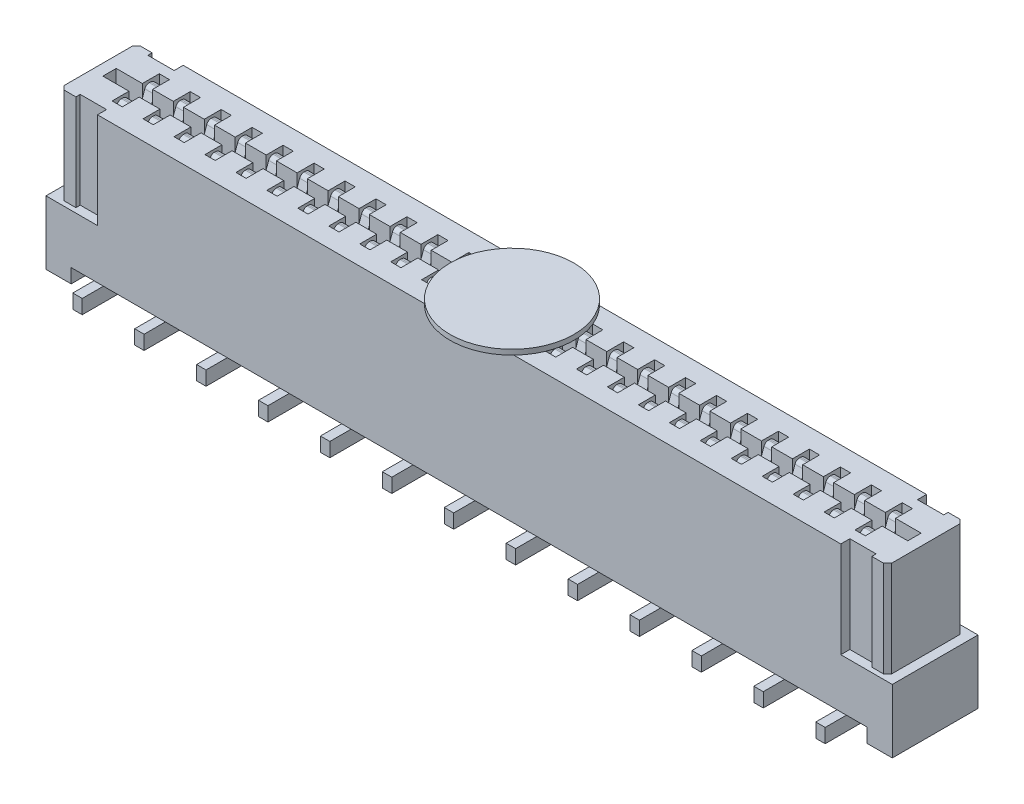
from build123d import *

# Parameters (mm, degrees)
SKETCH1_W                   = 27.33675
SKETCH1_H                   = 5.1562
BASE_DEPTH                  = 1.3843
SKETCH2_W                   = 2.7686
SKETCH2_H                   = 3.0988
SIDE_CUT_DEPTH              = 0.3048
SKETCH3_W                   = 0.508
SKETCH3_H                   = 3.0988
WELD_TAB_SLOT_DEPTH         = 0.1524
SKETCH4_W                   = 0.8509
SKETCH4_H                   = 3.0988
WT_RETENTION_SLOT_DEPTH     = 0.2921
SKETCH5_W                   = 25.71115
SKETCH5_H                   = 2.7686
STANDOFF_DEPTH              = 0.4572
MIRROR10_COPY_1_SKETCH_W    = 0.508
MIRROR10_COPY_1_SKETCH_H    = 3.0988
MIRROR10_COPY_1_DEPTH       = 0.1524
MIRROR10_COPY_2_SKETCH_W    = 0.8509
MIRROR10_COPY_2_SKETCH_H    = 3.0988
MIRROR10_COPY_2_DEPTH       = 0.2921
SKETCH7_W                   = 0.3302
SKETCH7_H                   = 1.8288
SLOT_CUT_DEPTH              = 1.397
CUT_EXTRUDE7_REACH          = 16.13
SKETCH8_W                   = 0.3302
SKETCH8_H                   = 1.524
SKETCH10_W                  = 25.999948
SKETCH10_H                  = 0.4318
CARD_SLOT_DEPTH             = 3.4544
POSITION_PATTERN_COUNT      = 25
POSITION_PATTERN_PITCH      = 0.999998
CHAMFER1_SIZE               = 0.127
F_01_LEAD_STYLE_PIN_R_DEPTH = 0.1524
F_01_PIN_R_PATTERN_COUNT    = 12
F_01_PIN_R_PATTERN_PITCH    = 1.999996
F_01_LEAD_STYLE_PIN_L_DEPTH = 0.1524
F_01_PIN_L_PATTERN_COUNT    = 13
F_01_PIN_L_PATTERN_PITCH    = 1.999996
SKETCH17_R                  = 2.00025
KAPTON_DEPTH                = 0.1651


with BuildPart() as part:
    # Sketch1 → Base (new, symmetric)
    with BuildSketch(Plane.XY):
        with Locations((0, 0.0635)):
            Rectangle(SKETCH1_W, SKETCH1_H)
    extrude(amount=BASE_DEPTH, both=True)

    # Sketch2 → Side Cut (cut)
    with BuildSketch(Plane(origin=(13.668375, 0, 0), x_dir=(0, 0, -1), z_dir=(1, 0, 0))):
        with Locations((0, 1.0922)):
            Rectangle(SKETCH2_W, SKETCH2_H)
    side_cut = extrude(amount=-SIDE_CUT_DEPTH, mode=Mode.SUBTRACT)

    # Sketch3 → Weld Tab Slot (cut)
    with BuildSketch(Plane.XY.offset(1.3843)):
        with Locations((13.109575, 1.0922)):
            Rectangle(SKETCH3_W, SKETCH3_H)
    weld_tab_slot = extrude(amount=-WELD_TAB_SLOT_DEPTH, mode=Mode.SUBTRACT)

    # Sketch4 → WT Retention Slot (cut)
    with BuildSketch(Plane.XY.offset(1.3843)):
        with Locations((12.430125, 1.0922)):
            Rectangle(SKETCH4_W, SKETCH4_H)
    wt_retention_slot = extrude(amount=-WT_RETENTION_SLOT_DEPTH, mode=Mode.SUBTRACT)

    # Sketch5 → Standoff (cut)
    with BuildSketch(Plane.XZ.offset(2.5146)):
        Rectangle(SKETCH5_W, SKETCH5_H)
    extrude(amount=-STANDOFF_DEPTH, mode=Mode.SUBTRACT)

    # Mirror8: Weld Tab Slot, WT Retention Slot across plane
    add(weld_tab_slot.mirror(Plane.XY), mode=Mode.SUBTRACT)
    add(wt_retention_slot.mirror(Plane.XY), mode=Mode.SUBTRACT)

    # Mirror10: Side Cut, Weld Tab Slot, WT Retention Slot across plane
    add(side_cut.mirror(Plane(origin=(0, 0, 0), x_dir=(0, 0, 1), z_dir=(1, 0, 0))), mode=Mode.SUBTRACT)
    add(weld_tab_slot.mirror(Plane(origin=(0, 0, 0), x_dir=(0, 0, 1), z_dir=(1, 0, 0))), mode=Mode.SUBTRACT)
    add(wt_retention_slot.mirror(Plane(origin=(0, 0, 0), x_dir=(0, 0, 1), z_dir=(1, 0, 0))), mode=Mode.SUBTRACT)

    # Mirror10 copy 1 sketch → Mirror10 copy 1 (cut)
    with BuildSketch(Plane(origin=(0, 0, -1.3843), x_dir=(-1, 0, 0), z_dir=(0, 0, -1))):
        with Locations((13.109575, 1.0922)):
            Rectangle(MIRROR10_COPY_1_SKETCH_W, MIRROR10_COPY_1_SKETCH_H)
    extrude(amount=-MIRROR10_COPY_1_DEPTH, mode=Mode.SUBTRACT)

    # Mirror10 copy 2 sketch → Mirror10 copy 2 (cut)
    with BuildSketch(Plane(origin=(0, 0, -1.3843), x_dir=(-1, 0, 0), z_dir=(0, 0, -1))):
        with Locations((12.430125, 1.0922)):
            Rectangle(MIRROR10_COPY_2_SKETCH_W, MIRROR10_COPY_2_SKETCH_H)
    extrude(amount=-MIRROR10_COPY_2_DEPTH, mode=Mode.SUBTRACT)

    # Sketch7 → Slot Cut (cut)
    with BuildSketch(Plane.XZ.offset(2.0574)):
        with Locations((12.008866, 0)):
            Rectangle(SKETCH7_W, SKETCH7_H)
    slot_cut = extrude(amount=-SLOT_CUT_DEPTH, mode=Mode.SUBTRACT)

    # Sketch8 → Cut-Extrude7 (cut, up to next)
    with BuildSketch(Plane.XZ.offset(0.6604), mode=Mode.PRIVATE) as cut_extrude7_sk1:
        with Locations((12.008866, 0)):
            Rectangle(SKETCH8_W, SKETCH8_H)
    cut_extrude7_tool1 = extrude(cut_extrude7_sk1.sketch, amount=-CUT_EXTRUDE7_REACH, mode=Mode.PRIVATE) & part.part
    cut_extrude7 = cut_extrude7_tool1.solids().sort_by_distance((12.008866, -0.6604, 0))[0]
    add(cut_extrude7, mode=Mode.SUBTRACT)

    # Sketch10 → Card slot (cut)
    with BuildSketch(Plane(origin=(0, 2.6416, 0), x_dir=(-1, 0, 0), z_dir=(0, 1, 0))):
        Rectangle(SKETCH10_W, SKETCH10_H)
    extrude(amount=-CARD_SLOT_DEPTH, mode=Mode.SUBTRACT)

    # Position Pattern: Slot Cut, Cut-Extrude7 ×25
    with Locations(*[(-i * POSITION_PATTERN_PITCH, 0, 0) for i in range(1, POSITION_PATTERN_COUNT)]):
        add(slot_cut, mode=Mode.SUBTRACT)
        add(cut_extrude7, mode=Mode.SUBTRACT)

    # Chamfer1
    chamfer1_edges = [part.edges().sort_by_distance(p)[0] for p in [
        (-13.363575, 1.0922, -1.2319),
        (13.363575, 1.0922, -1.2319),
        (13.363575, 1.0922, 1.2319),
        (-13.363575, 1.0922, 1.2319),
    ]]
    chamfer(chamfer1_edges, length=CHAMFER1_SIZE)

    # Sketch11 → -01 Lead Style Pin (R) (add, symmetric)
    with BuildSketch(Plane(origin=(11.008868, 0, 0), x_dir=(0, 0, -1), z_dir=(1, 0, 0))):
        with BuildLine():
            Line((0.6223, 2.413), (0.6223, -0.252665004))
            Line((0.6223, -0.252665004), (0.9017, -0.7366))
            Line((0.9017, -0.7366), (0.9017, -2.0828))
            Line((0.9017, -2.0828), (2.0447, -2.0828))
            Line((2.0447, -2.0828), (2.0447, -2.54))
            Line((2.0447, -2.54), (0.5334, -2.54))
            ThreePointArc((0.5334, -2.54), (0.443597439, -2.502802561), (0.4064, -2.413))
            Line((0.4064, -2.413), (0.4064, -2.2098))
            Line((0.4064, -2.2098), (-0.9017, -2.2098))
            Line((-0.9017, -2.2098), (-0.9017, -0.7366))
            Line((-0.9017, -0.7366), (-0.6223, -0.252665004))
            Line((-0.6223, -0.252665004), (-0.6223, 2.413))
            ThreePointArc((-0.6223, 2.413), (-0.577663073, 2.520763073), (-0.4699, 2.5654))
            Line((-0.4699, 2.5654), (-0.42760882, 2.5654))
            ThreePointArc((-0.42760882, 2.5654), (-0.339726472, 2.537508847), (-0.284011316, 2.464044266))
            Line((-0.284011316, 2.464044266), (-0.085506242, 1.905610664))
            ThreePointArc((-0.085506242, 1.905610664), (-0.063500101, 1.777722246), (-0.085692683, 1.649866049))
            Line((-0.085692683, 1.649866049), (-0.257822927, 1.16785804))
            ThreePointArc((-0.257822927, 1.16785804), (-0.264464333, 1.142612785), (-0.2667, 1.116604459))
            Line((-0.2667, 1.116604459), (-0.2667, -0.4699))
            ThreePointArc((-0.2667, -0.4699), (-0.188585379, -0.658485379), (0, -0.7366))
            ThreePointArc((0, -0.7366), (0.188585379, -0.658485379), (0.2667, -0.4699))
            Line((0.2667, -0.4699), (0.2667, 1.116604459))
            ThreePointArc((0.2667, 1.116604459), (0.264464333, 1.142612785), (0.257822927, 1.16785804))
            Line((0.257822927, 1.16785804), (0.085692683, 1.649866049))
            ThreePointArc((0.085692683, 1.649866049), (0.063500101, 1.777722246), (0.085506242, 1.905610664))
            Line((0.085506242, 1.905610664), (0.284011316, 2.464044266))
            ThreePointArc((0.284011316, 2.464044266), (0.339726472, 2.537508847), (0.42760882, 2.5654))
            Line((0.42760882, 2.5654), (0.4699, 2.5654))
            ThreePointArc((0.4699, 2.5654), (0.577663073, 2.520763073), (0.6223, 2.413))
        make_face()
    f_01_lead_style_pin_r = extrude(amount=F_01_LEAD_STYLE_PIN_R_DEPTH, both=True)

    # -01 Pin (R) Pattern: -01 Lead Style Pin (R) ×12
    with Locations(*[(-i * F_01_PIN_R_PATTERN_PITCH, 0, 0) for i in range(1, F_01_PIN_R_PATTERN_COUNT)]):
        add(f_01_lead_style_pin_r)

    # Sketch12 → -01 Lead Style Pin (L) (add, symmetric)
    with BuildSketch(Plane(origin=(12.008866, 0, 0), x_dir=(0, 0, -1), z_dir=(1, 0, 0))):
        with BuildLine():
            Line((-0.6223, 2.413), (-0.6223, -0.252665004))
            Line((-0.6223, -0.252665004), (-0.9017, -0.7366))
            Line((-0.9017, -0.7366), (-0.9017, -2.0828))
            Line((-0.9017, -2.0828), (-2.0447, -2.0828))
            Line((-2.0447, -2.0828), (-2.0447, -2.54))
            Line((-2.0447, -2.54), (-0.5334, -2.54))
            ThreePointArc((-0.5334, -2.54), (-0.443597439, -2.502802561), (-0.4064, -2.413))
            Line((-0.4064, -2.413), (-0.4064, -2.2098))
            Line((-0.4064, -2.2098), (0.9017, -2.2098))
            Line((0.9017, -2.2098), (0.9017, -0.7366))
            Line((0.9017, -0.7366), (0.6223, -0.252665004))
            Line((0.6223, -0.252665004), (0.6223, 2.413))
            ThreePointArc((0.6223, 2.413), (0.577663073, 2.520763073), (0.4699, 2.5654))
            Line((0.4699, 2.5654), (0.42760882, 2.5654))
            ThreePointArc((0.42760882, 2.5654), (0.339726472, 2.537508847), (0.284011316, 2.464044266))
            Line((0.284011316, 2.464044266), (0.085506242, 1.905610664))
            ThreePointArc((0.085506242, 1.905610664), (0.063500101, 1.777722246), (0.085692683, 1.649866049))
            Line((0.085692683, 1.649866049), (0.257822927, 1.16785804))
            ThreePointArc((0.257822927, 1.16785804), (0.264464333, 1.142612785), (0.2667, 1.116604459))
            Line((0.2667, 1.116604459), (0.2667, -0.4699))
            ThreePointArc((0.2667, -0.4699), (0.188585379, -0.658485379), (0, -0.7366))
            ThreePointArc((0, -0.7366), (-0.188585379, -0.658485379), (-0.2667, -0.4699))
            Line((-0.2667, -0.4699), (-0.2667, 1.116604459))
            ThreePointArc((-0.2667, 1.116604459), (-0.264464333, 1.142612785), (-0.257822927, 1.16785804))
            Line((-0.257822927, 1.16785804), (-0.085692683, 1.649866049))
            ThreePointArc((-0.085692683, 1.649866049), (-0.063500101, 1.777722246), (-0.085506242, 1.905610664))
            Line((-0.085506242, 1.905610664), (-0.284011316, 2.464044266))
            ThreePointArc((-0.284011316, 2.464044266), (-0.339726472, 2.537508847), (-0.42760882, 2.5654))
            Line((-0.42760882, 2.5654), (-0.4699, 2.5654))
            ThreePointArc((-0.4699, 2.5654), (-0.577663073, 2.520763073), (-0.6223, 2.413))
        make_face()
    f_01_lead_style_pin_l = extrude(amount=F_01_LEAD_STYLE_PIN_L_DEPTH, both=True)

    # -01 Pin (L) Pattern: -01 Lead Style Pin (L) ×13
    with Locations(*[(-i * F_01_PIN_L_PATTERN_PITCH, 0, 0) for i in range(1, F_01_PIN_L_PATTERN_COUNT)]):
        add(f_01_lead_style_pin_l)

    # Sketch17 → -KAPTON (add)
    with BuildSketch(Plane(origin=(0, 2.6416, 0), x_dir=(1, 0, 0), z_dir=(0, 1, 0))):
        Circle(SKETCH17_R)
    extrude(amount=KAPTON_DEPTH)


solid = part.part
